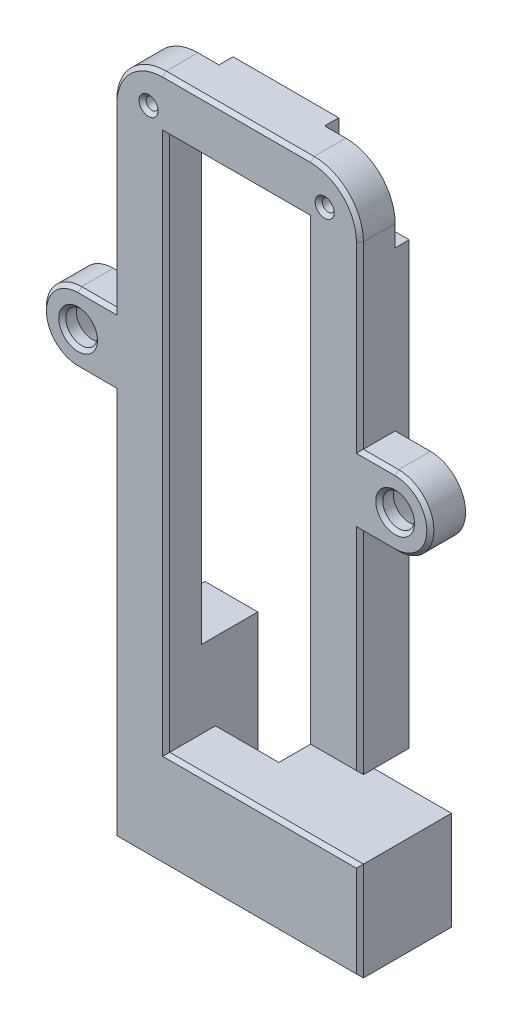
from build123d import *
from OCP.BRepFilletAPI import BRepFilletAPI_MakeChamfer

# Parameters (mm, degrees)
SKETCH1_R                = 0.85
BOSS_EXTRUDE1_DEPTH      = 5
BOSS_EXTRUDE2_DEPTH      = 2
SKETCH3_R                = 2.25
BOSS_EXTRUDE3_DEPTH      = 5
SKETCH4_R                = 3.5
CUT_EXTRUDE1_DEPTH       = 3
SKETCH5_W                = 10
SKETCH5_H                = 10
CUT_EXTRUDE2_DEPTH       = 47.770717335
FILLET1_R                = 7
BOSS_EXTRUDE4_DEPTH      = 5
BOSS_EXTRUDE4_DEPTH_BACK = 8
SKETCH6_W                = 7.5
SKETCH6_H                = 25
SKETCH7_W                = 7
SKETCH7_H                = 14
BOSS_EXTRUDE5_DEPTH      = 27.5
SKETCH8_W                = 18.5
SKETCH8_H                = 14
BOSS_EXTRUDE6_DEPTH      = 6
CHAMFER3_SIZE            = 0.5
CHAMFER1_SIZE            = 2.5
CHAMFER1_SIZE_2          = 1.25


with BuildPart() as part:
    # Sketch1 → Boss-Extrude1 (new body)
    with BuildSketch(Plane.XY):
        Polygon((-10, -35), (-10, 30), (10, 30), (10, -35), (17.5, -35), (17.5, 37.5), (-17.5, 37.5), (-17.5, -35), align=None)
        with Locations((-12.5, 32.5)):
            Circle(SKETCH1_R, mode=Mode.SUBTRACT)
        with Locations((12.5, 32.5)):
            Circle(SKETCH1_R, mode=Mode.SUBTRACT)
    extrude(amount=BOSS_EXTRUDE1_DEPTH)

    # Sketch2 → Boss-Extrude2 (add)
    with BuildSketch(Plane.XY):
        Polygon((17.5, -35), (17.5, 37.5), (-17.5, 37.5), (-17.5, -35), (-15.1, -35), (-15.1, 35.1), (15.1, 35.1), (15.1, -35), align=None)
    extrude(amount=-BOSS_EXTRUDE2_DEPTH)

    # Sketch3 → Boss-Extrude3 (add)
    # profile 1 of 2: a face of its own
    with BuildSketch(Plane.XY):
        with BuildLine():
            Line((22.5, 5), (17.5, 5))
            Line((17.5, 5), (17.5, -5))
            Line((17.5, -5), (22.5, -5))
            ThreePointArc((22.5, -5), (27.5, 0), (22.5, 5))
        make_face()
        with Locations(Location((22.5, 0, 0), (0, 0, 180))):
            Circle(SKETCH3_R, mode=Mode.SUBTRACT)
    # profile 2 of 2: a face of its own
    with BuildSketch(Plane.XY):
        with BuildLine():
            Line((-22.5, 5), (-17.5, 5))
            Line((-17.5, 5), (-17.5, -5))
            Line((-17.5, -5), (-22.5, -5))
            ThreePointArc((-22.5, -5), (-27.5, 0), (-22.5, 5))
        make_face()
        with Locations(Location((-22.5, 0, 0), (0, 0, 180))):
            Circle(SKETCH3_R, mode=Mode.SUBTRACT)
    extrude(amount=BOSS_EXTRUDE3_DEPTH)

    # Sketch4 → Cut-Extrude1 (cut)
    with BuildSketch(Plane(origin=(0, 0, 0), x_dir=(-1, 0, 0), z_dir=(0, 0, -1))):
        with Locations((-22.5, 0)):
            Circle(SKETCH4_R)
        with Locations((22.5, 0)):
            Circle(SKETCH4_R)
    extrude(amount=-CUT_EXTRUDE1_DEPTH, mode=Mode.SUBTRACT)

    # Sketch5 → Cut-Extrude2 (cut, through all)
    with BuildSketch(Plane(origin=(0, 0, 0), x_dir=(-1, 0, 0), z_dir=(0, 0, -1))):
        with Locations((-12.5, 32.5)):
            Rectangle(SKETCH5_W, SKETCH5_H)
        with Locations((12.5, 32.5)):
            Rectangle(SKETCH5_W, SKETCH5_H)
    extrude(amount=CUT_EXTRUDE2_DEPTH, mode=Mode.SUBTRACT)

    # Fillet1
    fillet1_edges = [part.edges().sort_by_distance(p)[0] for p in [
        (-17.5, 37.5, 2.5),
        (17.5, 37.5, 2.5),
    ]]
    fillet(fillet1_edges, radius=FILLET1_R)

    # Sketch6 → Boss-Extrude4 (add, two sides: drawn at the far end of the back side and taken through both)
    with BuildSketch(Plane.XY.offset(-BOSS_EXTRUDE4_DEPTH_BACK)):
        with Locations((-13.75, -47.5)):
            Rectangle(SKETCH6_W, SKETCH6_H)
    extrude(amount=BOSS_EXTRUDE4_DEPTH + BOSS_EXTRUDE4_DEPTH_BACK)

    # Sketch7 → Boss-Extrude5 (add)
    with BuildSketch(Plane(origin=(-10, 0, 0), x_dir=(0, 0, -1), z_dir=(1, 0, 0))):
        with Locations((-1.5, -53)):
            Rectangle(SKETCH7_W, SKETCH7_H)
    extrude(amount=BOSS_EXTRUDE5_DEPTH)

    # Sketch8 → Boss-Extrude6 (add)
    with BuildSketch(Plane(origin=(0, 0, -2), x_dir=(-1, 0, 0), z_dir=(0, 0, -1))):
        with Locations((-8.25, -53)):
            Rectangle(SKETCH8_W, SKETCH8_H)
    extrude(amount=BOSS_EXTRUDE6_DEPTH)

    # Chamfer3
    chamfer3_edges = [part.edges().sort_by_distance(p)[0] for p in [
        (0, 30, 5),
        (-17.5, -32.5, 5),
        (0, 37.5, 5),
        (15.449747468, 35.449747468, 5),
        (-15.449747468, 35.449747468, 5),
        (0, -60, 5),
        (10, -2.5, 5),
        (-10, -8, 5),
        (17.5, -53, 5),
        (3.75, -46, 5),
        (13.75, -35, 5),
        (-13.35, 32.5, 0),
        (-13.35, 32.5, 5),
        (17.5, -20, 5),
        (11.65, 32.5, 0),
        (11.65, 32.5, 5),
        (27.5, 0, 5),
        (20, 5, 5),
        (20, -5, 5),
        (24.75, 0, 5),
        (-27.5, 0, 5),
        (-20, -5, 5),
        (-20, 5, 5),
        (-20.25, 0, 5),
    ]]
    chamfer(chamfer3_edges, length=CHAMFER3_SIZE)

    # Chamfer1
    chamfer1_edges_1 = [part.edges().sort_by_distance(p)[0] for p in [
        (26, 0, 3),
    ]]
    chamfer1_side_1 = [part.faces().sort_by_distance(p)[0] for p in [
        (26, 0, 2.975),
    ]]
    chamfer1_edges_2 = [part.edges().sort_by_distance(p)[0] for p in [
        (-19, 0, 3),
    ]]
    chamfer1_side_2 = [part.faces().sort_by_distance(p)[0] for p in [
        (-19, 0, 2.975),
    ]]
    chamfer1 = BRepFilletAPI_MakeChamfer(part.part.solid().wrapped)
    for e in chamfer1_edges_1:
        chamfer1.Add(CHAMFER1_SIZE - 0.0001, CHAMFER1_SIZE_2 - 0.0001, e.wrapped, chamfer1_side_1[0].wrapped)
    for e in chamfer1_edges_2:
        chamfer1.Add(CHAMFER1_SIZE - 0.0001, CHAMFER1_SIZE_2 - 0.0001, e.wrapped, chamfer1_side_2[0].wrapped)
    add(Compound.cast(chamfer1.Shape()), mode=Mode.REPLACE)  # a hair under: the kernel refuses the full size


solid = part.part
